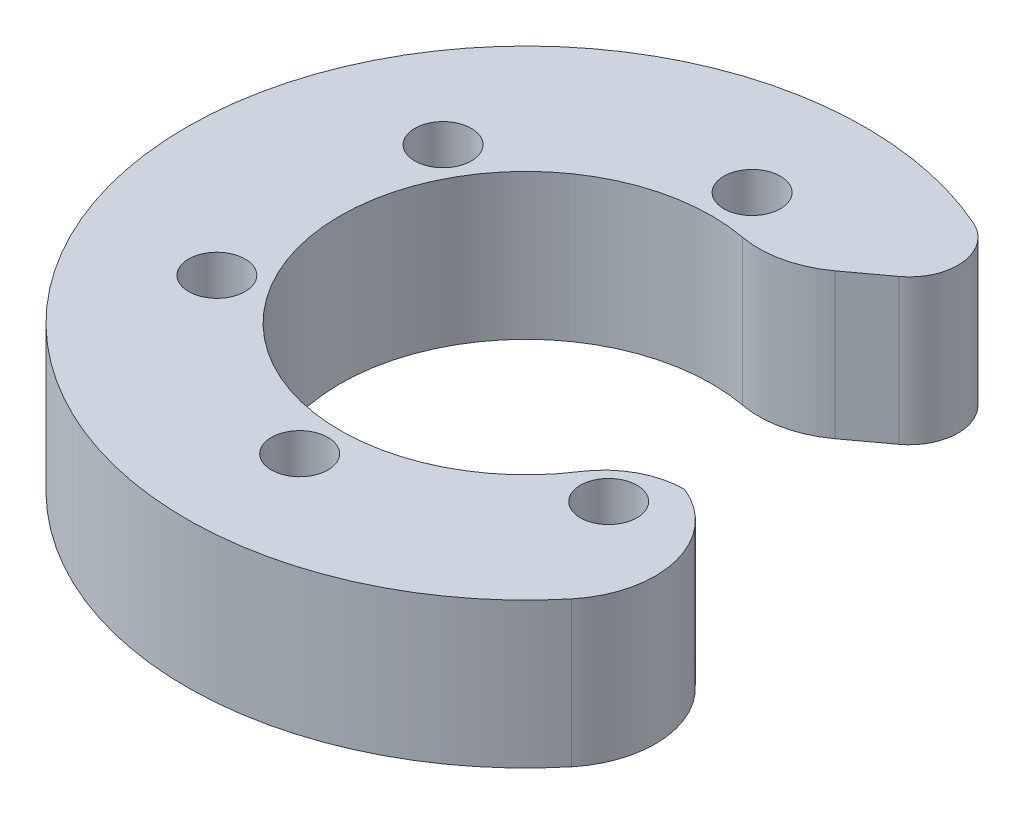
from build123d import *

# Parameters (mm, degrees)
SKETCH_1_R               = 21
EXTRUDE_1_DEPTH          = 9
HOLE_WIZARD_1_D          = 3.5
PATTERN_CIRCULAR_1_COUNT = 6
HOLE_WIZARD_2_D          = 23
SKETCH_7_W               = 20
SKETCH_7_H               = 8
CUT_EXTRUDE_1_DEPTH      = 10
FILLET_1_R               = 5
FILLET_2_R               = 6
CUT_EXTRUDE_2_DEPTH      = 10
FILLET_3_R               = 6
FILLET_4_R               = 3


with BuildPart() as part:
    # 草图1 → 凸台-拉伸1 (new body)
    with BuildSketch(Plane(origin=(0, 0, 0), x_dir=(1, 0, 0), z_dir=(0, 1, 0))):
        with Locations(Location((0, 0, 0), (0, 0, 270))):
            Circle(SKETCH_1_R)
    extrude(amount=EXTRUDE_1_DEPTH)

    # 孔1 (through all)
    with Locations(Plane(origin=(0, 9, 0), x_dir=(1, 0, 0), z_dir=(0, 1, 0))):
        with Locations((0, 14)):
            hole_wizard_1 = Hole(HOLE_WIZARD_1_D / 2)

    # 阵列(圆周)1: 孔1 ×6 about axis
    pattern_circular_1_axis = Axis((0, 0, 0), (0, 1, 0))
    for i in range(1, PATTERN_CIRCULAR_1_COUNT):
        add(hole_wizard_1.rotate(pattern_circular_1_axis, i * 360 / PATTERN_CIRCULAR_1_COUNT), mode=Mode.SUBTRACT)

    # 孔2 (through all)
    with Locations(Plane(origin=(0, 9, 0), x_dir=(1, 0, 0), z_dir=(0, 1, 0))):
        with Locations((0, 0)):
            Hole(HOLE_WIZARD_2_D / 2)

    # 草图7 → 切除-拉伸1 (cut)
    with BuildSketch(Plane.XZ):
        with Locations((14, 0)):
            Rectangle(SKETCH_7_W, SKETCH_7_H)
    extrude(amount=-CUT_EXTRUDE_1_DEPTH, mode=Mode.SUBTRACT)

    # 圆角1
    fillet_1_edges = [part.edges().sort_by_distance(p)[0] for p in [
        (10.781929326, 4.5, -4),
        (10.781929326, 4.5, 4),
    ]]
    fillet(fillet_1_edges, radius=FILLET_1_R)

    # 圆角2
    # the kernel refuses this fillet: 6 mm, written as the material it takes off along each edge
    with BuildSketch(Plane(origin=(20.615528128, 34.925810939, 4), x_dir=(-1, 0, 0), z_dir=(0, -1, 0))) as fillet_2_piece_1:
        with BuildLine():
            CenterArc((9.052881986, -5.555376193), FILLET_2_R, 112.196140843, 107.374202327)
            Line((4.427823529, -9.37752667), (4.33532236, -9.45396968))
            ThreePointArc((4.33532236, -9.45396968), (1.517440537, -5.017618885), (-0.117803018, -0.022857143))
            Line((-0.117803018, -0.022857143), (0, 0.12))
            ThreePointArc((0, 0.12), (3.393105721, 0.12), (6.740878031, 0.111107524))
            Line((6.740878031, 0.111107524), (6.786211442, 0))
        make_face()
    extrude(amount=60.851621878, mode=Mode.SUBTRACT)
    with BuildSketch(Plane(origin=(20.615528128, 34.925810939, -4), x_dir=(-0.42697059114477015, 0, -0.9042655109521127), z_dir=(0, -1, 0))) as fillet_2_piece_2:
        with BuildLine():
            CenterArc((8.888849465, -5.814226697), FILLET_2_R, 75.705116129, 107.374202327)
            Line((2.897512711, -6.136536957), (2.777685976, -6.142983162))
            ThreePointArc((2.777685976, -6.142983162), (1.340244494, -3.11950495), (-0.108511861, -0.051236471))
            Line((-0.108511861, -0.051236471), (-0.029629498, 0.116284534))
            ThreePointArc((-0.029629498, 0.116284534), (5.185162188, 0.770206559), (10.399953874, 0.116284534))
            Line((10.399953874, 0.116284534), (10.370324376, 0))
        make_face()
    extrude(amount=60.851621878, mode=Mode.SUBTRACT)

    # 草图8 → 切除-拉伸2 (cut)
    with BuildSketch(Plane(origin=(0, 0, 0), x_dir=(-1, 0, 0), z_dir=(0, -1, 0))):
        Polygon((1.25741602, 6.455059929), (-16.607431005, 19.620253888), (-25.506127326, 7.544940071), (-7.641280301, -5.620253888), align=None)
    extrude(amount=-CUT_EXTRUDE_2_DEPTH, mode=Mode.SUBTRACT)

    # 圆角3
    fillet_3_edges = [part.edges().sort_by_distance(p)[0] for p in [
        (4.400672865, 4.5, -10.624691917),
    ]]
    fillet(fillet_3_edges, radius=FILLET_3_R)

    # 圆角4
    fillet_4_edges = [part.edges().sort_by_distance(p)[0] for p in [
        (12.68916526, 4.5, -16.732754854),
    ]]
    fillet(fillet_4_edges, radius=FILLET_4_R)


solid = part.part
